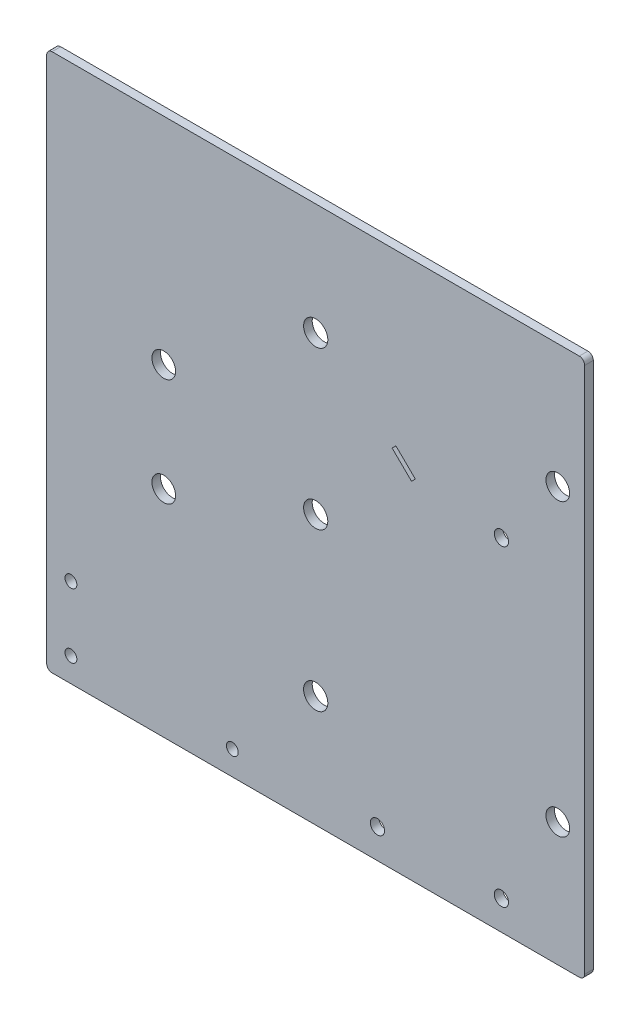
from build123d import *

# Parameters (mm, degrees)
SKETCH1_W           = 100
SKETCH1_H           = 100
BOSS_EXTRUDE1_DEPTH = 1.6
SKETCH3_R           = 2.2479
SKETCH3_R_2         = 1.325
SKETCH3_R_3         = 2.25
SKETCH3_R_4         = 2.2
SKETCH3_R_5         = 1.1
CUT_EXTRUDE2_DEPTH  = 71.728777736
FILLET1_R           = 1
CUT_EXTRUDE4_DEPTH  = 71.728777736


with BuildPart() as part:
    # Sketch1 → Boss-Extrude1 (new body)
    with BuildSketch(Plane.XY):
        Rectangle(SKETCH1_W, SKETCH1_H)
    extrude(amount=BOSS_EXTRUDE1_DEPTH)

    # Sketch3 → Cut-Extrude2 (cut, through all)
    with BuildSketch(Plane(origin=(0, 0, 1.6), x_dir=(-1, 0, 0), z_dir=(0, 0, -1))):
        Circle(SKETCH3_R)
        with Locations((-34.525, -44.525)):
            Circle(SKETCH3_R_2)
        with Locations((0, -29.25)):
            Circle(SKETCH3_R_3)
        with Locations((-45, -27)):
            Circle(SKETCH3_R_4)
        with Locations((0, 29.25)):
            Circle(SKETCH3_R_3)
        with Locations((-45, 27)):
            Circle(SKETCH3_R_4)
        with Locations((-34.525, 13.525)):
            Circle(SKETCH3_R_2)
        with Locations((15.5, -45.5)):
            Circle(SKETCH3_R_5)
        with Locations((45.5, -45.5)):
            Circle(SKETCH3_R_5)
        with Locations((45.5, -33.5)):
            Circle(SKETCH3_R_5)
        with Locations((-11.475, -44.525)):
            Circle(SKETCH3_R_2)
        with Locations((28.244666378, -9.999429886)):
            Circle(SKETCH3_R_4)
        with Locations((28.244666378, 10.000570114)):
            Circle(SKETCH3_R_4)
    extrude(amount=CUT_EXTRUDE2_DEPTH, mode=Mode.SUBTRACT)

    # Fillet1
    fillet1_edges = [part.edges().sort_by_distance(p)[0] for p in [
        (-50, -50, 0.8),
        (-50, 50, 0.8),
        (50, -50, 0.8),
        (50, 50, 0.8),
    ]]
    fillet(fillet1_edges, radius=FILLET1_R)

    # Sketch5 → Cut-Extrude4 (cut, through all)
    with BuildSketch(Plane(origin=(0, 0, 0), x_dir=(-1, 0, 0), z_dir=(0, 0, -1))):
        Polygon((-14.207463079, 17.79554595), (-17.818461517, 14.252475829), (-18.518822706, 14.966264457), (-14.907824268, 18.509334578), align=None)
    extrude(amount=-CUT_EXTRUDE4_DEPTH, mode=Mode.SUBTRACT)


solid = part.part
